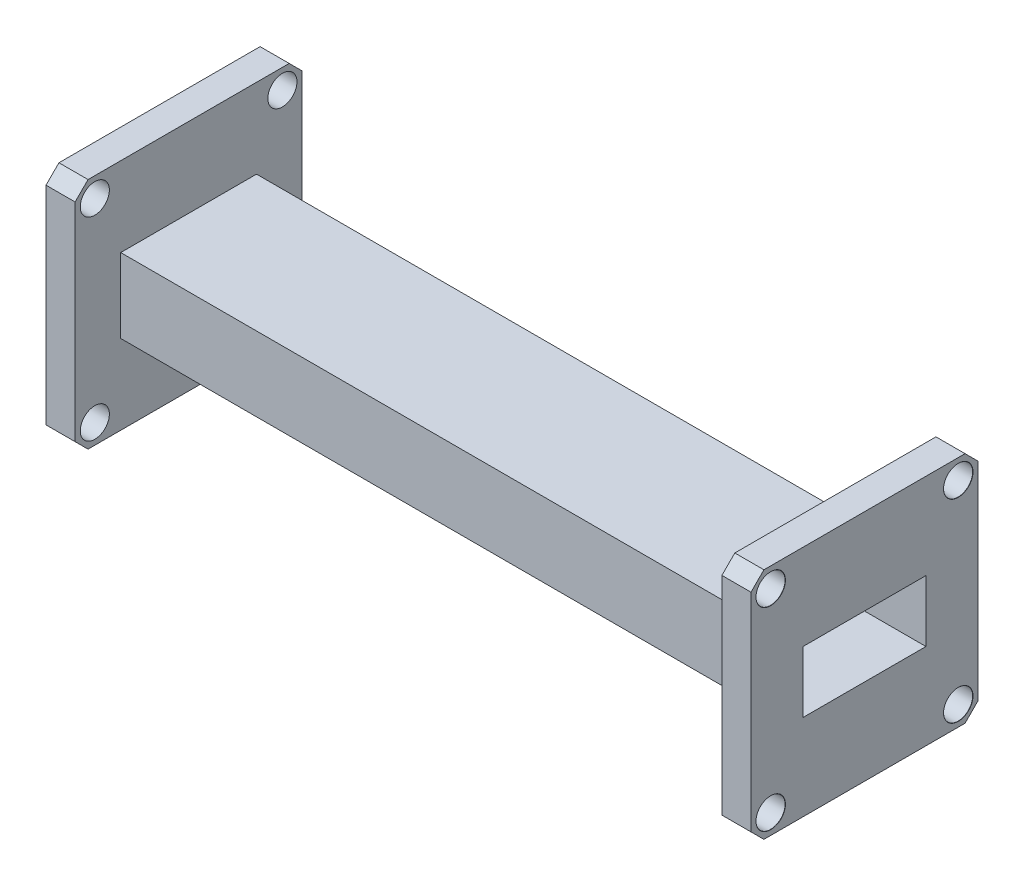
from build123d import *

# Parameters (mm, degrees)
SKETCH_1_W                  = 35.1
SKETCH_1_H                  = 36.1
SKETCH_1_W_2                = 19
SKETCH_1_H_2                = 9.5
EXTRUDE_1_DEPTH             = 4.5
CHAMFER_1_SIZE              = 2
SKETCH_4_W                  = 21
SKETCH_4_H                  = 11.5
SKETCH_4_W_2                = 19
SKETCH_4_H_2                = 9.5
EXTRUDE_2_DEPTH             = 100
SKETCH_5_W                  = 35.1
SKETCH_5_H                  = 36.1
SKETCH_5_W_2                = 19
SKETCH_5_H_2                = 9.5
EXTRUDE_3_DEPTH             = 4.5
CHAMFER_2_SIZE              = 2
PATTERN_LINEAR_1_COUNT      = 2
PATTERN_LINEAR_1_PITCH      = 29
PATTERN_LINEAR_1_COUNT_DIR2 = 2
PATTERN_LINEAR_1_PITCH_DIR2 = 30
HOLE_WIZARD_M42_D           = 4.5
HOLE_WIZARD_M42_CSINK_D     = 4.55
HOLE_WIZARD_M42_CSINK_ANGLE = 90


# Read off the part's stored shape, not the designer's step: Отверстие с зазором M41
with BuildPart() as part:
    # Эскиз1 → Бобышка-Вытянуть1 (new body)
    with BuildSketch(Plane(origin=(0, 0, 0), x_dir=(0, 0, -1), z_dir=(1, 0, 0))):
        Rectangle(SKETCH_1_W, SKETCH_1_H)
        Rectangle(SKETCH_1_W_2, SKETCH_1_H_2, mode=Mode.SUBTRACT)
    extrude(amount=EXTRUDE_1_DEPTH)

    # Фаска1
    chamfer_1_edges = [part.edges().sort_by_distance(p)[0] for p in [
        (2.25, -18.05, -17.55),
        (2.25, -18.05, 17.55),
        (2.25, 18.05, 17.55),
        (2.25, 18.05, -17.55),
    ]]
    chamfer(chamfer_1_edges, length=CHAMFER_1_SIZE)

    # Эскиз4 → Бобышка-Вытянуть2 (add)
    with BuildSketch(Plane(origin=(4.5, 0, 0), x_dir=(0, 0, -1), z_dir=(1, 0, 0))):
        Rectangle(SKETCH_4_W, SKETCH_4_H)
        Rectangle(SKETCH_4_W_2, SKETCH_4_H_2, mode=Mode.SUBTRACT)
    extrude(amount=EXTRUDE_2_DEPTH)

    # Эскиз5 → Бобышка-Вытянуть3 (add)
    with BuildSketch(Plane(origin=(104.5, 0, 0), x_dir=(0, 0, -1), z_dir=(1, 0, 0))):
        Rectangle(SKETCH_5_W, SKETCH_5_H)
        Rectangle(SKETCH_5_W_2, SKETCH_5_H_2, mode=Mode.SUBTRACT)
    extrude(amount=EXTRUDE_3_DEPTH)

    # Фаска2
    chamfer_2_edges = [part.edges().sort_by_distance(p)[0] for p in [
        (106.75, -18.05, -17.55),
        (106.75, 18.05, -17.55),
        (106.75, 18.05, 17.55),
        (106.75, -18.05, 17.55),
    ]]
    chamfer(chamfer_2_edges, length=CHAMFER_2_SIZE)

    # Отверстие с зазором M41 outline → Отверстие с зазором M41 (revolve, cut)
    with BuildSketch(Plane(origin=(0, 15, 14.5), x_dir=(0, 1, 0), z_dir=(0, 0, -1))):
        Polygon((2.25, 0.025), (2.25, 4.5), (0, 4.5), (0, 0), (2.275, 0), align=None)
    hole_wizard_m41 = revolve(axis=Axis((0, 15, 14.5), (1, 0, 0)), mode=Mode.SUBTRACT)

    # Линейный массив1: Hole Wizard M41 2 × 2
    with Locations(*[(0, -j * PATTERN_LINEAR_1_PITCH_DIR2, -i * PATTERN_LINEAR_1_PITCH) for i in range(PATTERN_LINEAR_1_COUNT) for j in range(PATTERN_LINEAR_1_COUNT_DIR2) if (i, j) != (0, 0)]):
        add(hole_wizard_m41, mode=Mode.SUBTRACT)

    # Отверстие с зазором M42 (through all)
    with Locations(Plane(origin=(109, 15, 14.5), x_dir=(0, 0, 1), z_dir=(1, 0, 0))):
        with Locations((0, 0), (-29, 0), (-29, 30), (0, 30)):
            CounterSinkHole(HOLE_WIZARD_M42_D / 2, HOLE_WIZARD_M42_CSINK_D / 2, counter_sink_angle=HOLE_WIZARD_M42_CSINK_ANGLE)


solid = part.part
